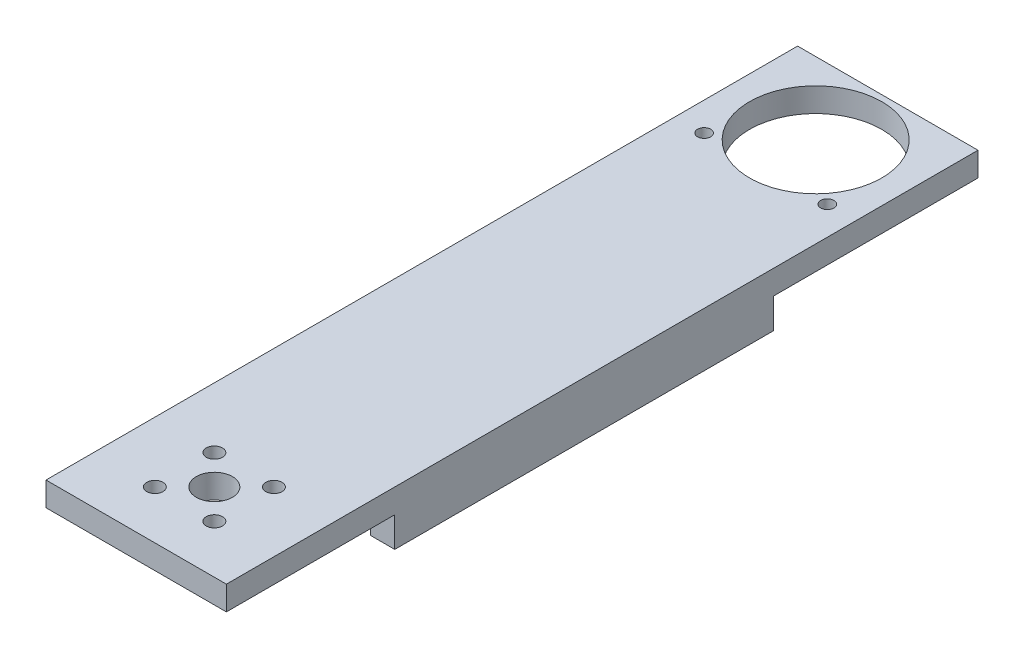
from build123d import *

# Parameters (mm, degrees)
S_BOX1_W      = 30
S_BOX1_H      = 4
BOSS_1_DEPTH  = 125
S_BOX2_W      = 4
S_BOX2_H      = 5.5
BOSS_2_DEPTH  = 63
S_BOX3_W      = 4
S_BOX3_H      = 5.5
BOSS_3_DEPTH  = 63
S_HOLE4_R     = 3
HOLE_4_DEPTH  = 4.2
S_HOLE5_R     = 1.35
HOLE_5_DEPTH  = 4.2
S_HOLE6_R     = 1.35
HOLE_6_DEPTH  = 4.2
S_HOLE7_R     = 1.35
HOLE_7_DEPTH  = 4.2
S_HOLE8_R     = 1.35
HOLE_8_DEPTH  = 4.2
S_HOLE9_R     = 11
HOLE_9_DEPTH  = 4.2
S_HOLE10_R    = 1.1
HOLE_10_DEPTH = 4.2
S_HOLE11_R    = 1.1
HOLE_11_DEPTH = 4.2
S_HOLE12_R    = 1.1
HOLE_12_DEPTH = 4.2
S_HOLE13_R    = 1.1
HOLE_13_DEPTH = 4.2


with BuildPart() as part:
    # S_box1 → Boss_1 (new body)
    with BuildSketch(Plane.XY.offset(-112)):
        with Locations((0, -18)):
            Rectangle(S_BOX1_W, S_BOX1_H)
    extrude(amount=BOSS_1_DEPTH)

    # S_box2 → Boss_2 (add)
    with BuildSketch(Plane.XY.offset(-78)):
        with Locations((-13, -22.25)):
            Rectangle(S_BOX2_W, S_BOX2_H)
    extrude(amount=BOSS_2_DEPTH)

    # S_box3 → Boss_3 (add)
    with BuildSketch(Plane.XY.offset(-78)):
        with Locations((13, -22.25)):
            Rectangle(S_BOX3_W, S_BOX3_H)
    extrude(amount=BOSS_3_DEPTH)

    # S_hole4 → Hole_4 (cut)
    with BuildSketch(Plane(origin=(0, -20.1, 0), x_dir=(1, 0, 0), z_dir=(0, 1, 0))):
        Circle(S_HOLE4_R)
    extrude(amount=HOLE_4_DEPTH, mode=Mode.SUBTRACT)

    # S_hole5 → Hole_5 (cut)
    with BuildSketch(Plane(origin=(0, -20.1, 0), x_dir=(1, 0, 0), z_dir=(0, 1, 0))):
        with Locations((4.949747468, -4.949747468)):
            Circle(S_HOLE5_R)
    extrude(amount=HOLE_5_DEPTH, mode=Mode.SUBTRACT)

    # S_hole6 → Hole_6 (cut)
    with BuildSketch(Plane(origin=(0, -20.1, 0), x_dir=(1, 0, 0), z_dir=(0, 1, 0))):
        with Locations((-4.949747468, -4.949747468)):
            Circle(S_HOLE6_R)
    extrude(amount=HOLE_6_DEPTH, mode=Mode.SUBTRACT)

    # S_hole7 → Hole_7 (cut)
    with BuildSketch(Plane(origin=(0, -20.1, 0), x_dir=(1, 0, 0), z_dir=(0, 1, 0))):
        with Locations((-4.949747468, 4.949747468)):
            Circle(S_HOLE7_R)
    extrude(amount=HOLE_7_DEPTH, mode=Mode.SUBTRACT)

    # S_hole8 → Hole_8 (cut)
    with BuildSketch(Plane(origin=(0, -20.1, 0), x_dir=(1, 0, 0), z_dir=(0, 1, 0))):
        with Locations((4.949747468, 4.949747468)):
            Circle(S_HOLE8_R)
    extrude(amount=HOLE_8_DEPTH, mode=Mode.SUBTRACT)

    # S_hole9 → Hole_9 (cut)
    with BuildSketch(Plane(origin=(0, -20.1, 0), x_dir=(1, 0, 0), z_dir=(0, 1, 0))):
        with Locations((0, 100)):
            Circle(S_HOLE9_R)
    extrude(amount=HOLE_9_DEPTH, mode=Mode.SUBTRACT)

    # S_hole10 → Hole_10 (cut)
    with BuildSketch(Plane(origin=(0, -20.1, 0), x_dir=(1, 0, 0), z_dir=(0, 1, 0))):
        with Locations((-10.25, 91.7)):
            Circle(S_HOLE10_R)
    extrude(amount=HOLE_10_DEPTH, mode=Mode.SUBTRACT)

    # S_hole11 → Hole_11 (cut)
    with BuildSketch(Plane(origin=(0, -20.1, 0), x_dir=(1, 0, 0), z_dir=(0, 1, 0))):
        with Locations((10.25, 91.7)):
            Circle(S_HOLE11_R)
    extrude(amount=HOLE_11_DEPTH, mode=Mode.SUBTRACT)

    # S_hole12 → Hole_12 (cut)
    with BuildSketch(Plane(origin=(0, -20.1, 0), x_dir=(1, 0, 0), z_dir=(0, 1, 0))):
        with Locations((-10.25, 67.25)):
            Circle(S_HOLE12_R)
    extrude(amount=-HOLE_12_DEPTH, mode=Mode.SUBTRACT)

    # S_hole13 → Hole_13 (cut)
    with BuildSketch(Plane(origin=(0, -20.1, 0), x_dir=(1, 0, 0), z_dir=(0, 1, 0))):
        with Locations((10.25, 67.25)):
            Circle(S_HOLE13_R)
    extrude(amount=-HOLE_13_DEPTH, mode=Mode.SUBTRACT)


solid = part.part
